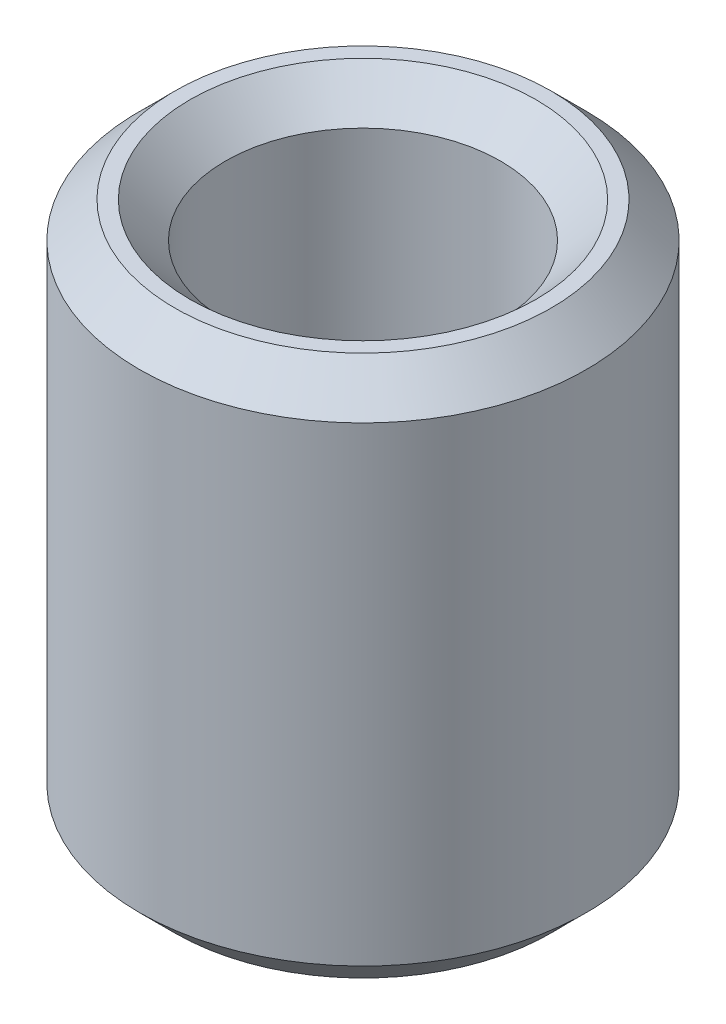
from build123d import *

# Parameters (mm, degrees)
SKETCH1_R           = 22.5
BOSS_EXTRUDE1_DEPTH = 54.471763246
SKETCH2_R           = 13.847194369
CUT_EXTRUDE1_DEPTH  = 64.08464941
CHAMFER1_SIZE       = 3.56541826


with BuildPart() as part:
    # Sketch1 → Boss-Extrude1 (new body)
    with BuildSketch(Plane(origin=(0, 0, 0), x_dir=(1, 0, 0), z_dir=(0, 1, 0))):
        Circle(SKETCH1_R)
    extrude(amount=BOSS_EXTRUDE1_DEPTH)

    # Sketch2 → Cut-Extrude1 (cut, through all)
    with BuildSketch(Plane(origin=(0, 0, 0), x_dir=(1, 0, 0), z_dir=(0, 1, 0))):
        Circle(SKETCH2_R)
    extrude(amount=CUT_EXTRUDE1_DEPTH, mode=Mode.SUBTRACT)

    # Chamfer1
    chamfer1_edges = [part.edges().sort_by_distance(p)[0] for p in [
        (-13.847194369, 54.471763246, 0),
        (-13.847194369, 0, 0),
        (-22.5, 0, 0),
        (-22.5, 54.471763246, 0),
    ]]
    chamfer(chamfer1_edges, length=CHAMFER1_SIZE)


solid = part.part
